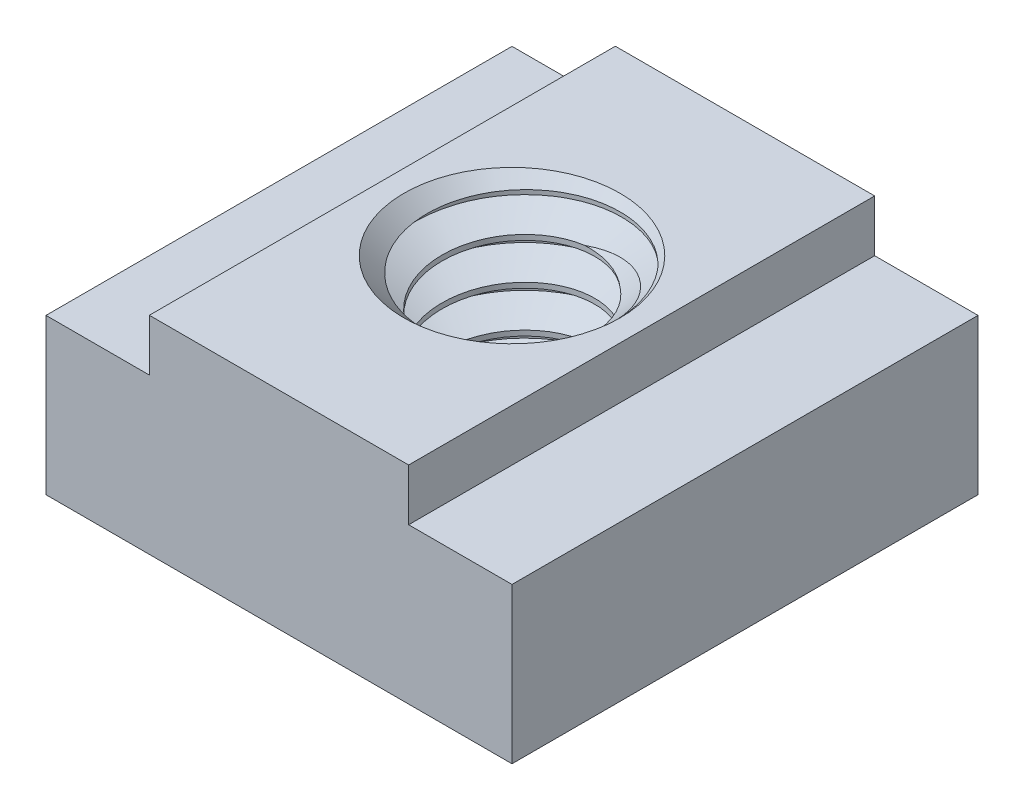
from build123d import *

# Parameters (mm, degrees)
BOSS_EXTRUDE1_START          = -7.14375
BOSS_EXTRUDE1_DEPTH          = 14.2875
SKETCH4_R                    = 3.175
CUT_EXTRUDE2_DEPTH           = 12.932679
SWEEP1_PITCH                 = 1.27
SKETCH8_R                    = 3.312481533
CUT_EXTRUDE3_OTHER_WAY_DEPTH = 13.582940668
CUT_EXTRUDE3_OTHER_WAY_TAPER = -45
SKETCH9_R                    = 3.312481533
CUT_EXTRUDE4_OTHER_WAY_DEPTH = 12.932679113
CUT_EXTRUDE4_OTHER_WAY_TAPER = -45


with BuildPart() as part:
    # Sketch3 → Boss-Extrude1 (new body)
    with BuildSketch(Plane.XY.offset(BOSS_EXTRUDE1_START)):
        Polygon((-7.14375, 0), (-7.14375, 4.7625), (-3.9751, 4.7625), (-3.9751, 6.35), (3.9751, 6.35), (3.9751, 4.7625), (7.14375, 4.7625), (7.14375, 0), align=None)
    extrude(amount=BOSS_EXTRUDE1_DEPTH)

    # Sketch4 → Cut-Extrude2 (cut, through all)
    with BuildSketch(Plane(origin=(0, 0, 0), x_dir=(1, 0, 0), z_dir=(0, 1, 0))):
        with Locations(Location((0, 0, 0), (0, 0, 270))):
            Circle(SKETCH4_R)
    extrude(amount=CUT_EXTRUDE2_DEPTH, mode=Mode.SUBTRACT)

    # Sweep1: the profile of Sketch6 screwed along a left-hand helix of 6 turns, 8 arcs to a turn; built about Z, then put on its axis
    sweep1_z = Axis((0, 0, 0), (0, 0, 1))
    sweep1_corners = [(3.243740766, 0, -1.1509375), (3.243740766, 0, 0.0396875), (2.350110803, 0, -0.47625), (2.350110803, 0, -0.635)]
    with BuildLine(mode=Mode.PRIVATE) as sweep1_profile:
        Line(sweep1_corners[0], sweep1_corners[1])
        Line(sweep1_corners[1], sweep1_corners[2])
        Line(sweep1_corners[2], sweep1_corners[3])
        Line(sweep1_corners[3], sweep1_corners[0])
    sweep1_cap = Face(sweep1_profile.wire())
    sweep1_turn_angles = [0, -22.5, -45, -67.5, -90, -112.5, -135, -157.5, -180, -202.5, -225, -247.5, -270, -292.5, -315, -337.5, -360]
    sweep1_turn_weights = [1, 0.9238795325112867, 1, 0.9238795325112867, 1, 0.9238795325112867, 1, 0.9238795325112867, 1, 0.9238795325112867, 1, 0.9238795325112867, 1, 0.9238795325112867, 1, 0.9238795325112867, 1]
    sweep1_turn_rails = [Edge.make_bspline([Vector(p[0], p[1], 0).rotate(sweep1_z, sweep1_turn_angles[k]) / sweep1_turn_weights[k] + Vector(0, 0, p[2] + -SWEEP1_PITCH * sweep1_turn_angles[k] / 360) for k in range(17)], [0, 0, 0, 1, 1, 2, 2, 3, 3, 4, 4, 5, 5, 6, 6, 7, 7, 8, 8, 8], 2, sweep1_turn_weights) for p in sweep1_corners]
    sweep1_turn_sides = [Face.make_surface_from_curves(sweep1_turn_rails[p[0]], sweep1_turn_rails[p[1]]) for p in [(0, 1), (1, 2), (2, 3), (3, 0)]]
    sweep1 = Plane(origin=(0, 6.35, 0), x_dir=(1, 0, 0), z_dir=(0, -1, 0)) * Solid(Shell([*[p.moved(Location((0, 0, SWEEP1_PITCH * i))) for i in range(6) for p in sweep1_turn_sides], sweep1_cap, sweep1_cap.rotate(sweep1_z, -2160).moved(Location((0, 0, -SWEEP1_PITCH * -2160 / 360)))]))
    add(sweep1)

    # Cut-Extrude3 cone 1 section (through the dimple's axis) → Cut-Extrude3 (revolve, cut)
    with BuildSketch(Plane(origin=(0, 0, 0), x_dir=(0, 0, -1), z_dir=(1, 0, 0))):
        Polygon((0, 0), (3.312481533, 0), (0, 3.312481533), align=None)
    revolve(axis=Axis((0, 0, 0), (0, 1, 0)), mode=Mode.SUBTRACT)

    # Sketch8 → Cut-Extrude3 other way (cut)
    with BuildSketch(Plane(origin=(0, 0, 0), x_dir=(1, 0, 0), z_dir=(0, 1, 0))):
        Circle(SKETCH8_R)
    extrude(amount=-CUT_EXTRUDE3_OTHER_WAY_DEPTH, taper=CUT_EXTRUDE3_OTHER_WAY_TAPER, mode=Mode.SUBTRACT)

    # Cut-Extrude4 cone 1 section (through the dimple's axis) → Cut-Extrude4 (revolve, cut)
    with BuildSketch(Plane(origin=(0, 6.35, 0), x_dir=(0, 0, 1), z_dir=(1, 0, 0))):
        Polygon((0, 0), (3.312481533, 0), (0, 3.312481533), align=None)
    revolve(axis=Axis((0, 6.35, 0), (0, -1, 0)), mode=Mode.SUBTRACT)

    # Sketch9 → Cut-Extrude4 other way (cut)
    with BuildSketch(Plane(origin=(0, 6.35, 0), x_dir=(1, 0, 0), z_dir=(0, 1, 0))):
        Circle(SKETCH9_R)
    extrude(amount=CUT_EXTRUDE4_OTHER_WAY_DEPTH, taper=CUT_EXTRUDE4_OTHER_WAY_TAPER, mode=Mode.SUBTRACT)


solid = part.part
